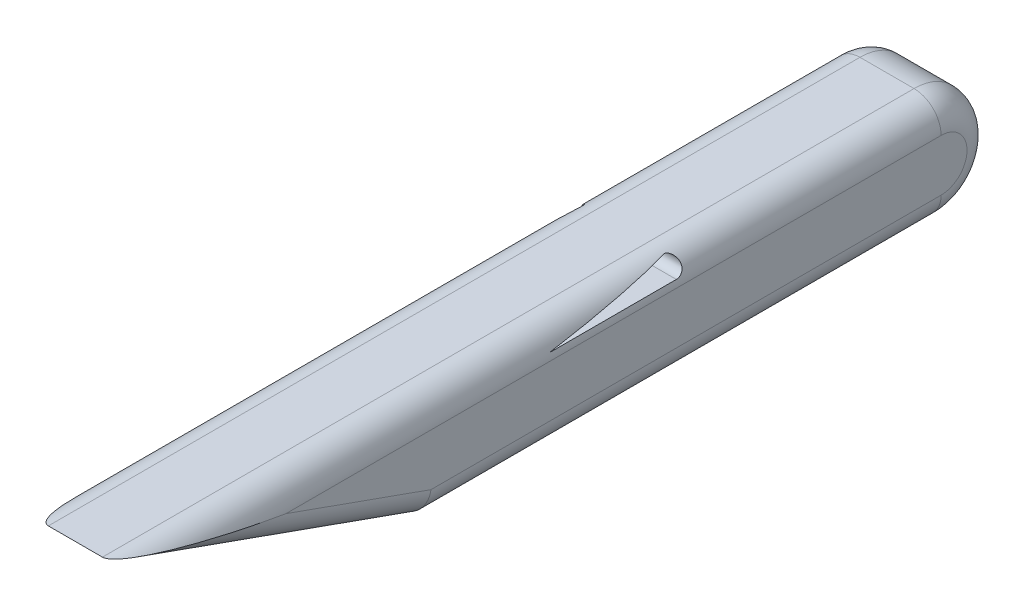
from build123d import *

# Parameters (mm, degrees)
BOSS_EXTRUDE1_DEPTH = 100
FILLET1_R           = 50
CUT_EXTRUDE1_DEPTH  = 300


with BuildPart() as part:
    # Sketch1 → Boss-Extrude1 (new, symmetric)
    with BuildSketch(Plane(origin=(0, 0, 0), x_dir=(0, 0, -1), z_dir=(1, 0, 0))):
        with BuildLine():
            Line((-537.016574586, 60.497237569), (11.602209945, -135.082872928))
            Line((11.602209945, -135.082872928), (962.983425414, -135.082872928))
            ThreePointArc((962.983425414, -135.082872928), (1060.773480663, -37.29281768), (962.983425414, 60.497237569))
            Line((962.983425414, 60.497237569), (-537.016574586, 60.497237569))
        make_face()
    extrude(amount=BOSS_EXTRUDE1_DEPTH, both=True)

    # Fillet1
    fillet1_edges = [part.edges().sort_by_distance(p)[0] for p in [
        (-100, -135.082872928, -487.29281768),
        (-100, -37.29281768, -1060.773480663),
        (100, 60.497237569, -212.983425414),
        (100, -37.29281768, -1060.773480663),
        (100, -37.29281768, 262.70718232),
        (-100, -37.29281768, 262.70718232),
        (-100, 60.497237569, -212.983425414),
        (100, -135.082872928, -487.29281768),
    ]]
    fillet(fillet1_edges, radius=FILLET1_R)

    # Sketch2 → Cut-Extrude1 (cut)
    with BuildSketch(Plane.ZY.offset(100)):
        with BuildLine():
            Line((-240.278412459, 23.075070398), (-475.216763111, 23.075070398))
            ThreePointArc((-475.216763111, 23.075070398), (-490.247556178, 39.100328004), (-473.293494818, 53.075070398))
            Line((-473.293494818, 53.075070398), (-240.278412459, 23.075070398))
        make_face()
    extrude(amount=-CUT_EXTRUDE1_DEPTH, mode=Mode.SUBTRACT)


solid = part.part
